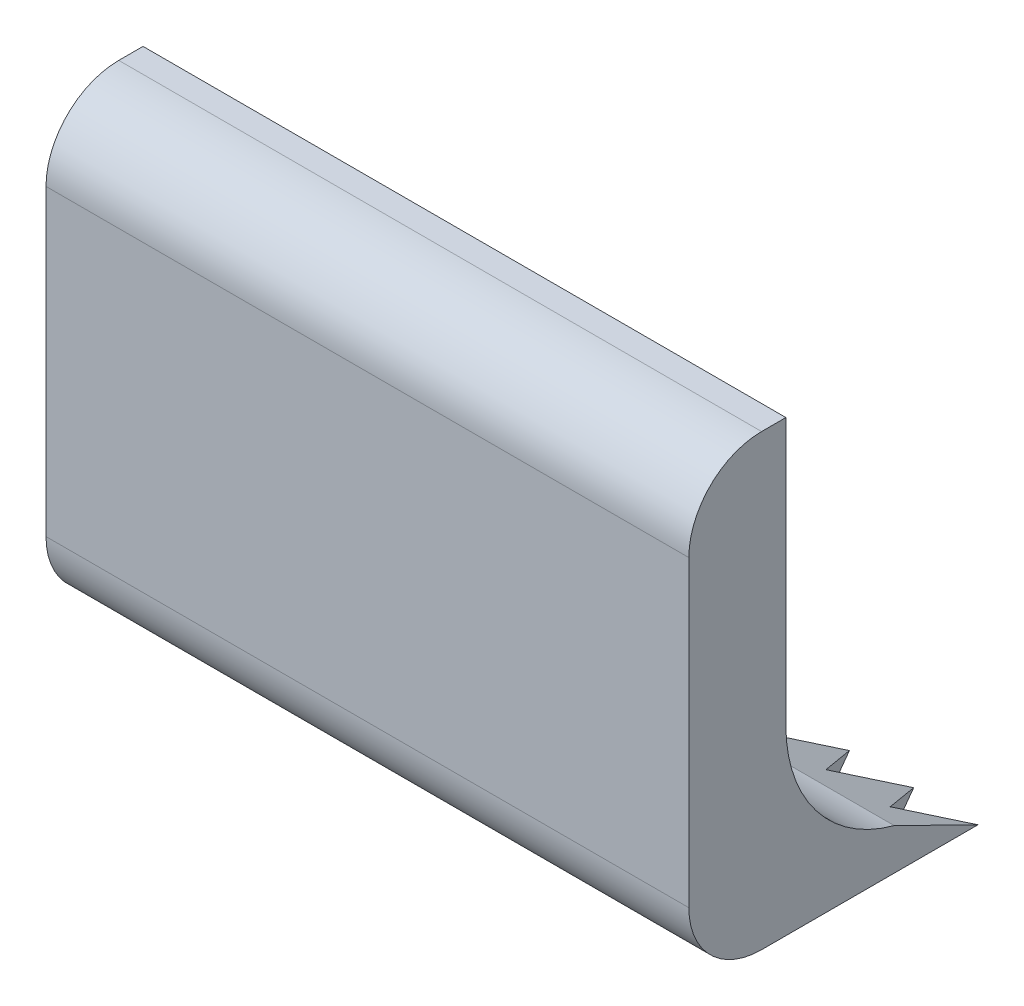
from build123d import *

# Parameters (mm, degrees)
BOSS_EXTRUDE1_DEPTH     = 26.5
CHAMFER1_START          = -5.68864596
CHAMFER1_OUTLINE_W      = 26.5
CHAMFER1_OUTLINE_H      = 7
CHAMFER1_DEPTH          = 3.235738337
CUT_EXTRUDE1_DEPTH      = 33.870959828
CUT_EXTRUDE1_DEPTH_BACK = 33.870959828


with BuildPart() as part:
    # Sketch1 → Boss-Extrude1 (new body)
    with BuildSketch(Plane(origin=(0, 0, 0), x_dir=(0, 0, -1), z_dir=(1, 0, 0))):
        with BuildLine():
            Line((-2, 9.25), (-3, 9.25))
            ThreePointArc((-3, 9.25), (-5.121320344, 8.371320344), (-6, 6.25))
            Line((-6, 6.25), (-6, -6.25))
            ThreePointArc((-6, -6.25), (-5.121320344, -8.371320344), (-3, -9.25))
            Line((-3, -9.25), (6, -9.25))
            Line((6, -9.25), (6, -7.75))
            Line((6, -7.75), (4, -7.75))
            ThreePointArc((4, -7.75), (-0.242640687, -5.992640687), (-2, -1.75))
            Line((-2, -1.75), (-2, 9.25))
        make_face()
    extrude(amount=BOSS_EXTRUDE1_DEPTH)

    # Chamfer1: read off the stored shape, not the designer's step
    # Chamfer1 outline → Chamfer1 (cut)
    with BuildSketch(Plane(origin=(0, 0, 0), x_dir=(1, 0, 0), z_dir=(0, 0.897390589003635, -0.441237046005556)).offset(CHAMFER1_START)):
        with Locations((13.25, 7.5)):
            Rectangle(CHAMFER1_OUTLINE_W, CHAMFER1_OUTLINE_H)
    extrude(amount=CHAMFER1_DEPTH, mode=Mode.SUBTRACT)

    # Sketch2 → Cut-Extrude1 (cut, two sides: drawn at the far end of the back side and taken through both)
    with BuildSketch(Plane.XZ.offset(9.25).offset(-CUT_EXTRUDE1_DEPTH_BACK)):
        Polygon((23.85, -5.920212303), (26.5, -5.920212303), (25.175, -3.625244983), align=None)
        Polygon((21.2, -5.920212303), (23.85, -5.920212303), (22.525, -3.625244983), align=None)
        Polygon((18.55, -5.920212303), (21.2, -5.920212303), (19.875, -3.625244983), align=None)
        Polygon((15.9, -5.920212303), (18.55, -5.920212303), (17.225, -3.625244983), align=None)
        Polygon((13.25, -5.920212303), (15.9, -5.920212303), (14.575, -3.625244983), align=None)
        Polygon((10.6, -5.920212303), (13.25, -5.920212303), (11.925, -3.625244983), align=None)
        Polygon((7.95, -5.920212303), (10.6, -5.920212303), (9.275, -3.625244983), align=None)
        Polygon((5.3, -5.920212303), (7.95, -5.920212303), (6.625, -3.625244983), align=None)
        Polygon((2.65, -5.920212303), (5.3, -5.920212303), (3.975, -3.625244983), align=None)
        Polygon((2.65, -5.920212303), (1.325, -3.625244983), (0, -5.920212303), align=None)
    extrude(amount=CUT_EXTRUDE1_DEPTH + CUT_EXTRUDE1_DEPTH_BACK, mode=Mode.SUBTRACT)


solid = part.part
